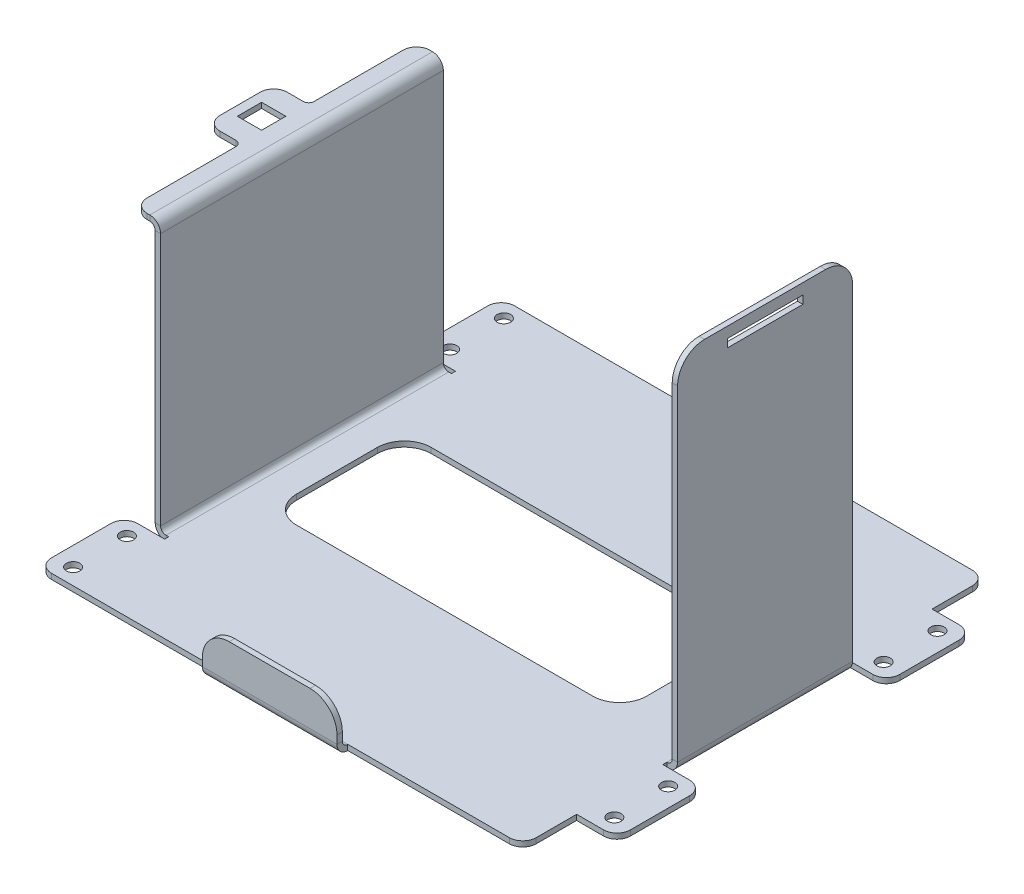
from build123d import *

# Parameters (mm, degrees)
SKETCH_2_R                   = 2.5
SM_BASE_FLANGE_1_DEPTH       = 2
FILLET_1_R                   = 5
SM_EDGE_FLANGE_1_DEPTH       = 105
SM_EDGE_FLANGE_2_DEPTH       = 65
SM_START                     = 2
SM_EDGE_FLANGE_2_PROFILE_W   = 65
SM_EDGE_FLANGE_2_PROFILE_H   = 131
SM_EDGE_FLANGE_2_PROFILE_W_2 = 28
SM_EDGE_FLANGE_2_PROFILE_H_2 = 3
SM_EDGE_FLANGE_2_FLAT_DEPTH  = 2
SM_EDGE_FLANGE_3_DEPTH       = 105
SM_EDGE_FLANGE_3_PROFILE_W   = 9
SM_EDGE_FLANGE_3_PROFILE_H   = 9
SM_EDGE_FLANGE_3_FLAT_DEPTH  = 2
FILLET_3_R                   = 5
FILLET_4_R                   = 2
SM_EDGE_FLANGE_4_DEPTH       = 50
SM_EDGE_FLANGE_4_BEND_DEPTH  = 50
FILLET_2_R                   = 10


# Sheet-metal steps are written as plain solids
with BuildPart() as part:
    # Sketch 2 → Базовая кромка1 (new body)
    with BuildSketch(Plane(origin=(0, 0, 0), x_dir=(1, 0, 0), z_dir=(0, 1, 0))):
        Polygon((-90, -54), (-90, -86), (90, -86), (90, -66), (105, -66), (105, -34), (90, -34), (90, 34), (105, 34), (105, 66), (90, 66), (90, 86), (-90, 86), (-90, 54), (-75, 54), (-75, -54), align=None)
        with Locations(Location((-83, 80, 0), (0, 0, 270))):
            Circle(SKETCH_2_R, mode=Mode.SUBTRACT)
        with Locations(Location((-83, 60, 0), (0, 0, 270))):
            Circle(SKETCH_2_R, mode=Mode.SUBTRACT)
        with Locations(Location((98, 60, 0), (0, 0, 270))):
            Circle(SKETCH_2_R, mode=Mode.SUBTRACT)
        with Locations(Location((98, 40, 0), (0, 0, 270))):
            Circle(SKETCH_2_R, mode=Mode.SUBTRACT)
        with Locations(Location((98, -40, 0), (0, 0, 270))):
            Circle(SKETCH_2_R, mode=Mode.SUBTRACT)
        with Locations(Location((98, -60, 0), (0, 0, 270))):
            Circle(SKETCH_2_R, mode=Mode.SUBTRACT)
        with Locations(Location((-83, -60, 0), (0, 0, 270))):
            Circle(SKETCH_2_R, mode=Mode.SUBTRACT)
        with Locations(Location((-83, -80, 0), (0, 0, 270))):
            Circle(SKETCH_2_R, mode=Mode.SUBTRACT)
        with BuildLine():
            Line((-65, 15), (-65, -15))
            ThreePointArc((-65, -15), (-62.071067812, -22.071067812), (-55, -25))
            Line((-55, -25), (55, -25))
            ThreePointArc((55, -25), (62.071067812, -22.071067812), (65, -15))
            Line((65, -15), (65, 15))
            ThreePointArc((65, 15), (62.071067812, 22.071067812), (55, 25))
            Line((55, 25), (-55, 25))
            ThreePointArc((-55, 25), (-62.071067812, 22.071067812), (-65, 15))
        make_face(mode=Mode.SUBTRACT)
    extrude(amount=-SM_BASE_FLANGE_1_DEPTH)

    # Скругление1
    fillet_1_edges = [part.edges().sort_by_distance(p)[0] for p in [
        (105, -1, 66),
        (90, -1, 86),
        (-90, -1, 86),
        (-90, -1, 54),
        (-90, -1, -54),
        (-90, -1, -86),
        (90, -1, -86),
        (105, -1, -66),
        (105, -1, -34),
        (105, -1, 34),
    ]]
    fillet(fillet_1_edges, radius=FILLET_1_R)

    # Ребро-кромка1 section (across the edge) → Ребро-кромка1 (add)
    with BuildSketch(Plane(origin=(-78, 0, -52.5), x_dir=(1, 0, 0), z_dir=(0, 0, 1))):
        with BuildLine():
            Line((-2, 2), (-2, 96))
            Line((-2, 96), (0, 96))
            Line((0, 96), (0, 2))
            ThreePointArc((0, 2), (0.585786438, 0.585786438), (2, 0))
            Line((2, 0), (3, 0))
            Line((3, 0), (3, -2))
            Line((3, -2), (2, -2))
            ThreePointArc((2, -2), (-0.828427125, -0.828427125), (-2, 2))
        make_face()
    extrude(amount=SM_EDGE_FLANGE_1_DEPTH)

    # Ребро-кромка2 bend section (across the edge) → Ребро-кромка2 (add)
    with BuildSketch(Plane(origin=(92, 0, 32.5), x_dir=(-1, 0, 0), z_dir=(0, 0, -1))):
        with BuildLine():
            Line((-2, 2), (0, 2))
            ThreePointArc((0, 2), (0.585786438, 0.585786438), (2, 0))
            Line((2, 0), (2, -2))
            ThreePointArc((2, -2), (-0.828427125, -0.828427125), (-2, 2))
        make_face()
    extrude(amount=SM_EDGE_FLANGE_2_DEPTH)

    # Ребро-кромка2 profile (on flange) → Ребро-кромка2 flat (add)
    with BuildSketch(Plane(origin=(92, 0, 0), x_dir=(0, 0, -1), z_dir=(1, 0, 0)).offset(SM_START)):
        with Locations((0, 67.5)):
            Rectangle(SM_EDGE_FLANGE_2_PROFILE_W, SM_EDGE_FLANGE_2_PROFILE_H)
        with Locations((0, 127.5)):
            Rectangle(SM_EDGE_FLANGE_2_PROFILE_W_2, SM_EDGE_FLANGE_2_PROFILE_H_2, mode=Mode.SUBTRACT)
    extrude(amount=-SM_EDGE_FLANGE_2_FLAT_DEPTH)

    # Ребро-кромка3 bend section (across the edge) → Ребро-кромка3 (add)
    with BuildSketch(Plane(origin=(-80, 98, 52.5), x_dir=(0, -1, 0), z_dir=(0, 0, -1))):
        with BuildLine():
            Line((-2, 2), (0, 2))
            ThreePointArc((0, 2), (0.585786438, 0.585786438), (2, 0))
            Line((2, 0), (2, -2))
            ThreePointArc((2, -2), (-0.828427125, -0.828427125), (-2, 2))
        make_face()
    extrude(amount=SM_EDGE_FLANGE_3_DEPTH)

    # Ребро-кромка3 profile (on flange) → Ребро-кромка3 flat (add)
    with BuildSketch(Plane(origin=(-80, 98, 0), x_dir=(0, 0, -1), z_dir=(0, 1, 0)).offset(SM_START)):
        Polygon((-52.5, 8), (-52.5, 2), (52.5, 2), (52.5, 8), (12.5, 8), (12.5, 21), (-12.5, 21), (-12.5, 8), align=None)
        with Locations((0, 13)):
            Rectangle(SM_EDGE_FLANGE_3_PROFILE_W, SM_EDGE_FLANGE_3_PROFILE_H, mode=Mode.SUBTRACT)
    extrude(amount=-SM_EDGE_FLANGE_3_FLAT_DEPTH)

    # Скругление3
    fillet_3_edges = [part.edges().sort_by_distance(p)[0] for p in [
        (-88, 99, 52.5),
        (-88, 99, -52.5),
        (-101, 99, -12.5),
        (-101, 99, 12.5),
    ]]
    fillet(fillet_3_edges, radius=FILLET_3_R)

    # Скругление4
    fillet_4_edges = [part.edges().sort_by_distance(p)[0] for p in [
        (-88, 99, -12.5),
        (-88, 99, 12.5),
    ]]
    fillet(fillet_4_edges, radius=FILLET_4_R)

    # Ребро-кромка4 section (across the edge) → Ребро-кромка4 (add)
    with BuildSketch(Plane(origin=(-25, 0, 88), x_dir=(0, 0, -1), z_dir=(1, 0, 0))):
        with BuildLine():
            Line((-2, 2), (-2, 15))
            Line((-2, 15), (0, 15))
            Line((0, 15), (0, 2))
            ThreePointArc((0, 2), (0.585786438, 0.585786438), (2, 0))
            Line((2, 0), (2, -2))
            ThreePointArc((2, -2), (-0.828427125, -0.828427125), (-2, 2))
        make_face()
    extrude(amount=SM_EDGE_FLANGE_4_DEPTH)

    # Ребро-кромка4 section 2 (across the edge) → Ребро-кромка4 bend (add)
    with BuildSketch(Plane(origin=(25, 0, -88), x_dir=(0, 0, 1), z_dir=(-1, 0, 0))):
        with BuildLine():
            Line((-2, 2), (-2, 15))
            Line((-2, 15), (0, 15))
            Line((0, 15), (0, 2))
            ThreePointArc((0, 2), (0.585786438, 0.585786438), (2, 0))
            Line((2, 0), (2, -2))
            ThreePointArc((2, -2), (-0.828427125, -0.828427125), (-2, 2))
        make_face()
    extrude(amount=SM_EDGE_FLANGE_4_BEND_DEPTH)

    # Скругление2
    fillet_2_edges = [part.edges().sort_by_distance(p)[0] for p in [
        (93, 133, 32.5),
        (93, 133, -32.5),
        (-25, 15, 89),
        (25, 15, 89),
        (25, 15, -89),
        (-25, 15, -89),
    ]]
    fillet(fillet_2_edges, radius=FILLET_2_R)


solid = part.part
